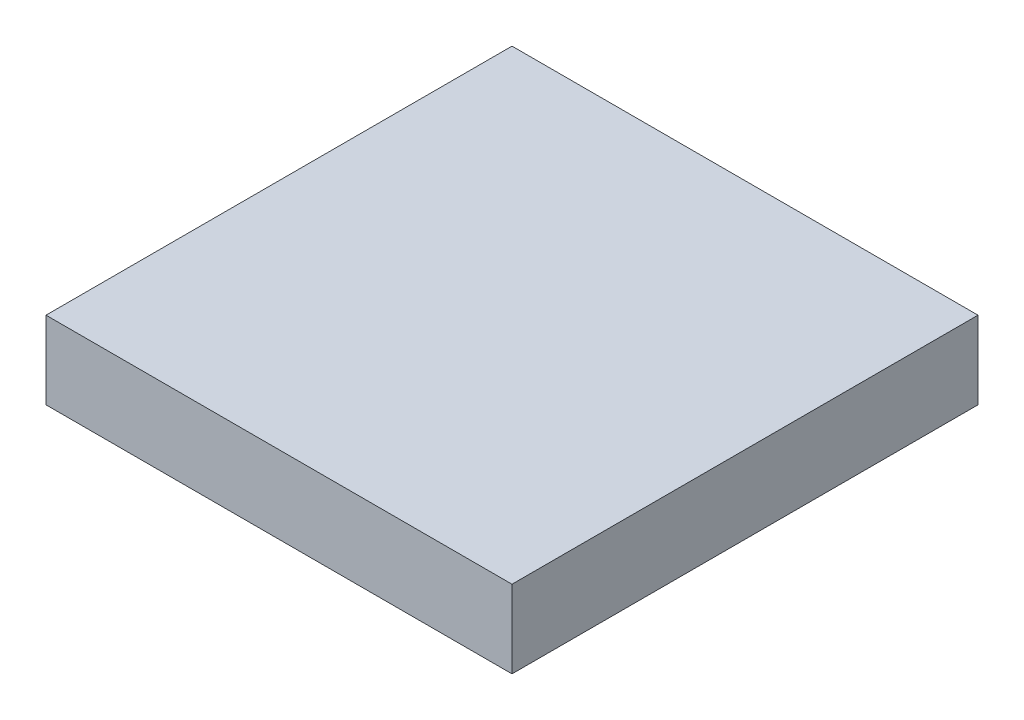
from build123d import *

# Parameters (mm, degrees)
SKETCH1_W           = 300
SKETCH1_H           = 300
BOSS_EXTRUDE1_DEPTH = 50


with BuildPart() as part:
    # Sketch1 → Boss-Extrude1 (new body)
    with BuildSketch(Plane(origin=(0, 0, 0), x_dir=(1, 0, 0), z_dir=(0, 1, 0))):
        with Locations((150, 150)):
            Rectangle(SKETCH1_W, SKETCH1_H)
    extrude(amount=BOSS_EXTRUDE1_DEPTH)


solid = part.part
